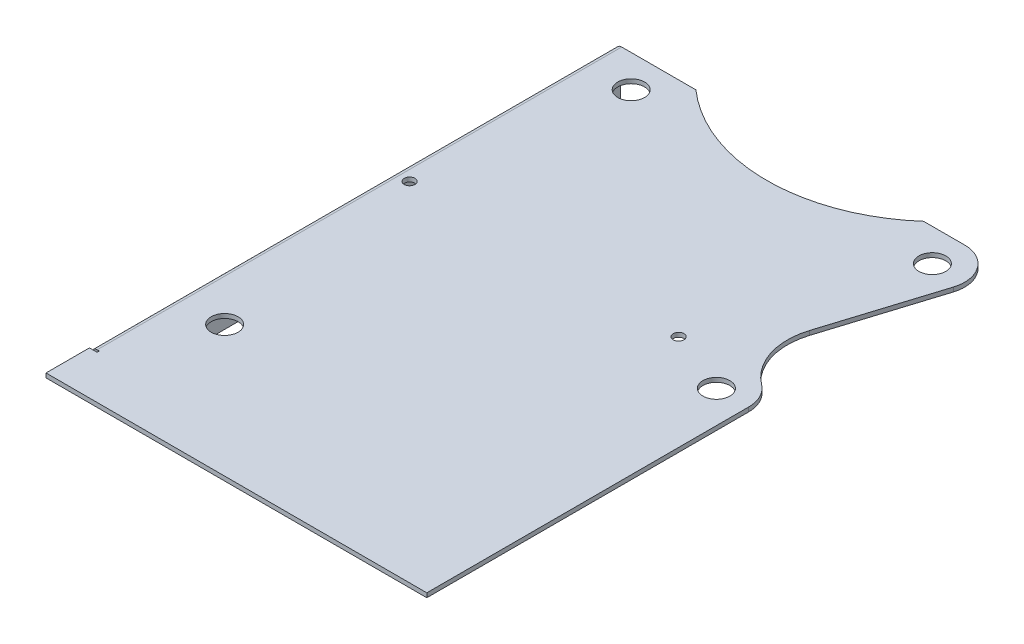
from build123d import *

# Parameters (mm, degrees)
SKETCH1_R                     = 7.9375
SKETCH1_R_2                   = 3.175
BASE_FLANGE1_DEPTH            = 2.54
EDGE_FLANGE2_STRIP_W          = 11.6332
EDGE_FLANGE2_STRIP_H          = 2.54
EDGE_FLANGE2_STRIP_CUT_DEPTH  = 309.626
EDGE_FLANGE2_RELIEF_W         = 12.9032
EDGE_FLANGE2_RELIEF_H         = 1.27
EDGE_FLANGE2_RELIEF_CUT_DEPTH = 2.54
EDGE_FLANGE2_DEPTH            = 309.626


# Sheet-metal steps are written as plain solids
with BuildPart() as part:
    # Sketch1 → Base-Flange1 (new body)
    with BuildSketch(Plane(origin=(0, 0, 0), x_dir=(1, 0, 0), z_dir=(0, 1, 0))):
        with BuildLine():
            Line((109.619528436, 311.807263764), (89.361961148, 247.115522342))
            ThreePointArc((89.361961148, 247.115522342), (89.460566801, 224.034337943), (102.867006006, 205.245559798))
            ThreePointArc((102.867006006, 205.245559798), (108.478001121, 198.524407286), (110.49, 190.003314763))
            Line((110.49, 190.003314763), (110.49, 0))
            Line((110.49, 0), (-114.3, 0))
            Line((-114.3, 0), (-114.3, 336.55))
            Line((-114.3, 336.55), (-67.202083301, 336.55))
            ThreePointArc((-67.202083301, 336.55), (0, 311.15), (67.202083301, 336.55))
            Line((67.202083301, 336.55), (91.44, 336.55))
            ThreePointArc((91.44, 336.55), (106.791695758, 328.779536221), (109.619528436, 311.807263764))
        make_face()
        with Locations(Location((-86.36, 317.5, 0), (0, 0, 270))):
            Circle(SKETCH1_R, mode=Mode.SUBTRACT)
        with Locations(Location((91.44, 317.5, 0), (0, 0, 270))):
            Circle(SKETCH1_R, mode=Mode.SUBTRACT)
        with Locations(Location((91.44, 190.003314763, 0), (0, 0, 270))):
            Circle(SKETCH1_R, mode=Mode.SUBTRACT)
        with Locations(Location((-86.36, 77.503314763, 0), (0, 0, 270))):
            Circle(SKETCH1_R, mode=Mode.SUBTRACT)
        with Locations(Location((-104.900544931, 205.245559798, 0), (0, 0, 270))):
            Circle(SKETCH1_R_2, mode=Mode.SUBTRACT)
        with Locations(Location((53.876660191, 205.245559798, 0), (0, 0, 270))):
            Circle(SKETCH1_R_2, mode=Mode.SUBTRACT)
    extrude(amount=-BASE_FLANGE1_DEPTH)

    # Edge-Flange2 strip (across the edge) → Edge-Flange2 strip cut (cut)
    with BuildSketch(Plane(origin=(-114.3, -2.54, -26.924), x_dir=(1, 0, 0), z_dir=(0, 0, -1))):
        with Locations((-2.54, -1.27)):
            Rectangle(EDGE_FLANGE2_STRIP_W, EDGE_FLANGE2_STRIP_H)
    extrude(amount=EDGE_FLANGE2_STRIP_CUT_DEPTH, mode=Mode.SUBTRACT)

    # Edge-Flange2 relief (on the sheet) → Edge-Flange2 relief cut (cut)
    with BuildSketch(Plane(origin=(-111.0234, -2.54, -26.924), x_dir=(1, 0, 0), z_dir=(0, -1, 0))):
        with Locations((-5.1816, 0.635)):
            Rectangle(EDGE_FLANGE2_RELIEF_W, EDGE_FLANGE2_RELIEF_H)
    extrude(amount=-EDGE_FLANGE2_RELIEF_CUT_DEPTH, mode=Mode.SUBTRACT)

    # Edge-Flange2 section (across the edge) → Edge-Flange2 (add)
    with BuildSketch(Plane(origin=(-114.3, -2.54, -26.924), x_dir=(1, 0, 0), z_dir=(0, 0, -1))):
        with BuildLine():
            Line((0, 0.7366), (0, 25.4))
            Line((0, 25.4), (2.54, 25.4))
            Line((2.54, 25.4), (2.54, 0.7366))
            ThreePointArc((2.54, 0.7366), (2.755745145, 0.215745145), (3.2766, 0))
            Line((3.2766, 0), (3.2766, -2.54))
            ThreePointArc((3.2766, -2.54), (0.959693921, -1.580306079), (0, 0.7366))
        make_face()
    extrude(amount=EDGE_FLANGE2_DEPTH)


solid = part.part
